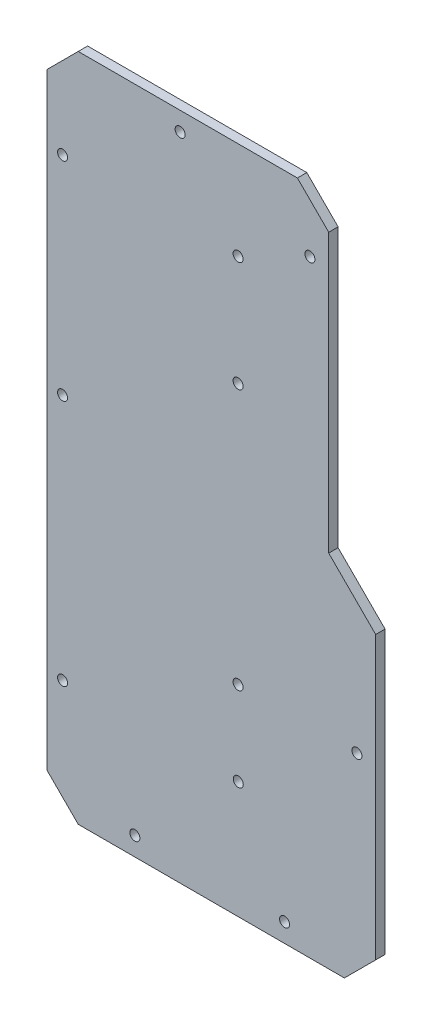
from build123d import *

# Parameters (mm, degrees)
SKETCH1_R      = 1.6
EXTRUDE1_DEPTH = 3


with BuildPart() as part:
    # Sketch1 → Extrude1 (new body)
    with BuildSketch(Plane.XY):
        Polygon((-70, 34.003545781), (0, 34.003545781), (10, 24.003545781), (10, -64.753959847), (25, -79.753959847), (25, -169.753959847), (15, -179.753959847), (0, -179.753959847), (-70, -179.753959847), (-80, -169.753959847), (-80, 24.003545781), align=None)
        with Locations((-75, 2.893545781)):
            Circle(SKETCH1_R, mode=Mode.SUBTRACT)
        with Locations((-18.946632771, 2.893545781)):
            Circle(SKETCH1_R, mode=Mode.SUBTRACT)
        with Locations((-75, -142.403959847)):
            Circle(SKETCH1_R, mode=Mode.SUBTRACT)
        with Locations((-18.893164364, -142.403959847)):
            Circle(SKETCH1_R, mode=Mode.SUBTRACT)
        with Locations((4, 14.243545781)):
            Circle(SKETCH1_R, mode=Mode.SUBTRACT)
        with Locations((-37.450797564, 28.003545781)):
            Circle(SKETCH1_R, mode=Mode.SUBTRACT)
        with Locations((-75, -63.550219221)):
            Circle(SKETCH1_R, mode=Mode.SUBTRACT)
        with Locations((-18.946632771, -115.582406174)):
            Circle(SKETCH1_R, mode=Mode.SUBTRACT)
        with Locations((-18.946632771, -32.301003494)):
            Circle(SKETCH1_R, mode=Mode.SUBTRACT)
        with Locations((19, -115.582406174)):
            Circle(SKETCH1_R, mode=Mode.SUBTRACT)
        with Locations((-51.91499669, -173.753959847)):
            Circle(SKETCH1_R, mode=Mode.SUBTRACT)
        with Locations((-4.115150986, -173.753959847)):
            Circle(SKETCH1_R, mode=Mode.SUBTRACT)
    extrude(amount=EXTRUDE1_DEPTH)


solid = part.part
